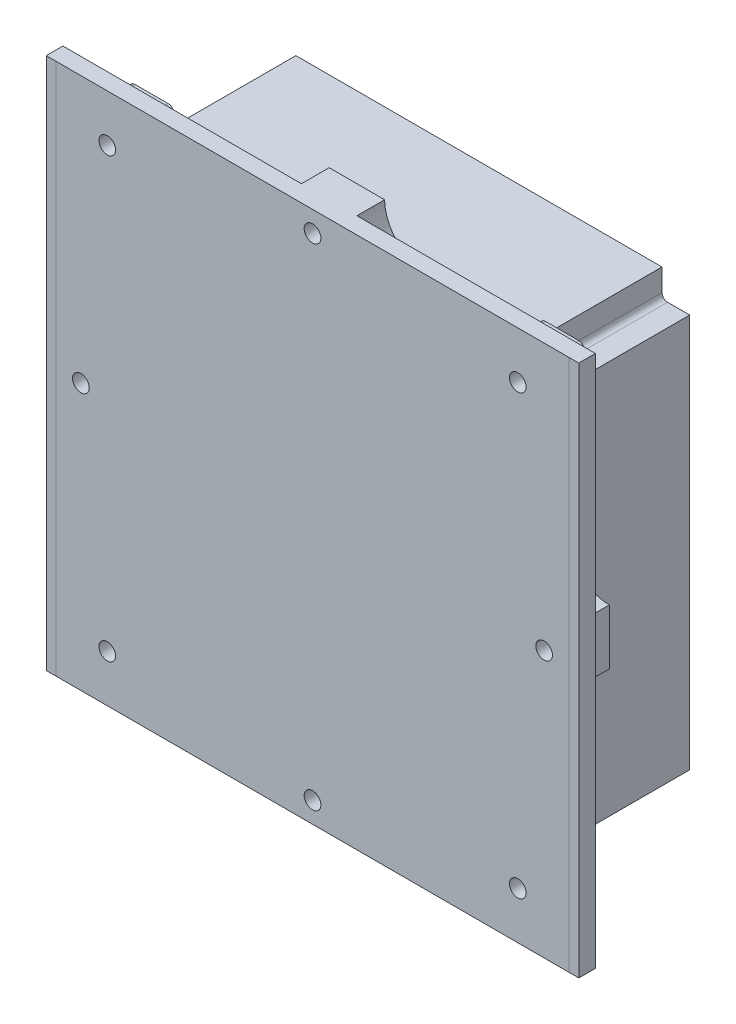
from build123d import *

# Parameters (mm, degrees)
SKETCH2_W           = 96
SKETCH2_H           = 96
BOSS_EXTRUDE1_DEPTH = 3
BOSS_EXTRUDE2_DEPTH = 27
BOSS_EXTRUDE6_DEPTH = 5
SKETCH18_R          = 1.5
CUT_EXTRUDE3_DEPTH  = 75.215901261
SKETCH16_W          = 5
SKETCH16_H          = 9.5
BOSS_EXTRUDE7_DEPTH = 15
SKETCH17_R          = 1.5
CUT_EXTRUDE2_DEPTH  = 3.175
FILLET2_R           = 1
SKETCH22_R          = 1.5
CUT_EXTRUDE5_DEPTH  = 75.215901261
CUT_EXTRUDE6_START  = -22
SKETCH23_R          = 1.5
CUT_EXTRUDE6_DEPTH  = 22
SKETCH24_W          = 82
SKETCH24_H          = 87
SKETCH24_W_2        = 76
SKETCH24_H_2        = 81
CUT_EXTRUDE8_DEPTH  = 22


with BuildPart() as part:
    # Sketch2 → Boss-Extrude1 (new body)
    with BuildSketch(Plane.XY):
        Rectangle(SKETCH2_W, SKETCH2_H)
    extrude(amount=-BOSS_EXTRUDE1_DEPTH)

    # Sketch3 → Boss-Extrude2 (add)
    with BuildSketch(Plane(origin=(0, 0, -3), x_dir=(-1, 0, 0), z_dir=(0, 0, -1))):
        with BuildLine():
            ThreePointArc((-33, -42.5), (-32.414213562, -41.085786438), (-31, -40.5))
            Line((-31, -40.5), (31, -40.5))
            ThreePointArc((31, -40.5), (32.414213562, -41.085786438), (33, -42.5))
            Line((33, -42.5), (33, -43.5))
            Line((33, -43.5), (41, -43.5))
            Line((41, -43.5), (41, -35.5))
            Line((41, -35.5), (40, -35.5))
            ThreePointArc((40, -35.5), (38.585786438, -34.914213562), (38, -33.5))
            Line((38, -33.5), (38, 33.5))
            ThreePointArc((38, 33.5), (38.585786438, 34.914213562), (40, 35.5))
            Line((40, 35.5), (41, 35.5))
            Line((41, 35.5), (41, 43.5))
            Line((41, 43.5), (33, 43.5))
            Line((33, 43.5), (33, 42.5))
            ThreePointArc((33, 42.5), (32.414213562, 41.085786438), (31, 40.5))
            Line((31, 40.5), (-31, 40.5))
            ThreePointArc((-31, 40.5), (-32.414213562, 41.085786438), (-33, 42.5))
            Line((-33, 42.5), (-33, 43.5))
            Line((-33, 43.5), (-41, 43.5))
            Line((-41, 43.5), (-41, 35.5))
            Line((-41, 35.5), (-40, 35.5))
            ThreePointArc((-40, 35.5), (-38.585786438, 34.914213562), (-38, 33.5))
            Line((-38, 33.5), (-38, -33.5))
            ThreePointArc((-38, -33.5), (-38.585786438, -34.914213562), (-40, -35.5))
            Line((-40, -35.5), (-41, -35.5))
            Line((-41, -35.5), (-41, -43.5))
            Line((-41, -43.5), (-33, -43.5))
            Line((-33, -43.5), (-33, -42.5))
        make_face()
        with BuildLine():
            Line((-35, -22.5), (-35, 22.5))
            ThreePointArc((-35, 22.5), (-30.606601718, 33.106601718), (-20, 37.5))
            Line((-20, 37.5), (20, 37.5))
            ThreePointArc((20, 37.5), (30.606601718, 33.106601718), (35, 22.5))
            Line((35, 22.5), (35, -22.5))
            ThreePointArc((35, -22.5), (30.606601718, -33.106601718), (20, -37.5))
            Line((20, -37.5), (-20, -37.5))
            ThreePointArc((-20, -37.5), (-30.606601718, -33.106601718), (-35, -22.5))
        make_face(mode=Mode.SUBTRACT)
    extrude(amount=BOSS_EXTRUDE2_DEPTH)

    # Sketch15 → Boss-Extrude6 (add)
    with BuildSketch(Plane(origin=(0, 0, -3), x_dir=(-1, 0, 0), z_dir=(0, 0, -1))):
        with BuildLine():
            Line((-5, 48), (5, 48))
            ThreePointArc((5, 48), (7.196699141, 42.696699141), (12.5, 40.5))
            Line((12.5, 40.5), (-12.5, 40.5))
            ThreePointArc((-12.5, 40.5), (-7.196699141, 42.696699141), (-5, 48))
        make_face()
        with BuildLine():
            Line((45.5, 5), (45.5, -5))
            ThreePointArc((45.5, -5), (40.196699141, -7.196699141), (38, -12.5))
            Line((38, -12.5), (38, 12.5))
            ThreePointArc((38, 12.5), (40.196699141, 7.196699141), (45.5, 5))
        make_face()
        with BuildLine():
            Line((5, -48), (-5, -48))
            ThreePointArc((-5, -48), (-7.196699141, -42.696699141), (-12.5, -40.5))
            Line((-12.5, -40.5), (12.5, -40.5))
            ThreePointArc((12.5, -40.5), (7.196699141, -42.696699141), (5, -48))
        make_face()
        with BuildLine():
            Line((-45.5, -5), (-45.5, 5))
            ThreePointArc((-45.5, 5), (-40.196699141, 7.196699141), (-38, 12.5))
            Line((-38, 12.5), (-38, -12.5))
            ThreePointArc((-38, -12.5), (-40.196699141, -7.196699141), (-45.5, -5))
        make_face()
    extrude(amount=BOSS_EXTRUDE6_DEPTH)

    # Sketch18 → Cut-Extrude3 (cut, through all)
    with BuildSketch(Plane.XY):
        with Locations((0, 44.25)):
            Circle(SKETCH18_R)
        with Locations((0, -44.25)):
            Circle(SKETCH18_R)
        with Locations((41.75, 0)):
            Circle(SKETCH18_R)
        with Locations((-41.75, 0)):
            Circle(SKETCH18_R)
    extrude(amount=-CUT_EXTRUDE3_DEPTH, mode=Mode.SUBTRACT)

    # Sketch16 → Boss-Extrude7 (add)
    with BuildSketch(Plane(origin=(0, 0, -3), x_dir=(-1, 0, 0), z_dir=(0, 0, -1))):
        with Locations((-32.5, 17.75)):
            Rectangle(SKETCH16_W, SKETCH16_H)
        with Locations((32.5, 17.75)):
            Rectangle(SKETCH16_W, SKETCH16_H)
    extrude(amount=BOSS_EXTRUDE7_DEPTH)

    # Sketch17 → Cut-Extrude2 (cut)
    with BuildSketch(Plane(origin=(0, 0, -18), x_dir=(-1, 0, 0), z_dir=(0, 0, -1))):
        with Locations((-32.5, 17.75)):
            Circle(SKETCH17_R)
        with Locations((32.5, 17.75)):
            Circle(SKETCH17_R)
    extrude(amount=-CUT_EXTRUDE2_DEPTH, mode=Mode.SUBTRACT)

    # Fillet2
    fillet2_edges = [part.edges().sort_by_distance(p)[0] for p in [
        (-33, 43.5, -16.5),
        (-41, 35.5, -16.5),
        (-41, 43.5, -16.5),
        (33, 43.5, -16.5),
        (41, 43.5, -16.5),
        (41, 35.5, -16.5),
        (41, -35.5, -16.5),
        (33, -43.5, -16.5),
        (-33, -43.5, -16.5),
        (-41, -35.5, -16.5),
        (-41, -43.5, -16.5),
        (41, -43.5, -16.5),
    ]]
    fillet(fillet2_edges, radius=FILLET2_R - 0.0001)  # a hair under: the kernel refuses the full size

    # Sketch22 → Cut-Extrude5 (cut, through all)
    with BuildSketch(Plane.XY):
        with Locations((37, 39.5)):
            Circle(SKETCH22_R)
        with Locations(Location((-37, 39.5, 0), (0, 0, 180))):
            Circle(SKETCH22_R)
        with Locations(Location((37, -39.5, 0), (0, 0, 180))):
            Circle(SKETCH22_R)
        with Locations((-37, -39.5)):
            Circle(SKETCH22_R)
    extrude(amount=-CUT_EXTRUDE5_DEPTH, mode=Mode.SUBTRACT)

    # Sketch23 → Cut-Extrude6 (cut)
    # profile 1 of 4: a face of its own
    with BuildSketch(Plane(origin=(0, 0, -30), x_dir=(-1, 0, 0), z_dir=(0, 0, -1)).offset(CUT_EXTRUDE6_START)):
        with BuildLine():
            ThreePointArc((34, 35.5), (33.292893219, 35.792893219), (33, 36.5))
            Line((33, 36.5), (33, 42.5))
            ThreePointArc((33, 42.5), (33.292893219, 43.207106781), (34, 43.5))
            Line((34, 43.5), (40, 43.5))
            ThreePointArc((40, 43.5), (40.707106781, 43.207106781), (41, 42.5))
            Line((41, 42.5), (41, 36.5))
            ThreePointArc((41, 36.5), (40.707106781, 35.792893219), (40, 35.5))
            Line((40, 35.5), (34, 35.5))
        make_face()
        with Locations(Location((37, 39.5, 0), (0, 0, 180))):
            Circle(SKETCH23_R, mode=Mode.SUBTRACT)
    # profile 2 of 4: a face of its own
    with BuildSketch(Plane(origin=(0, 0, -30), x_dir=(-1, 0, 0), z_dir=(0, 0, -1)).offset(CUT_EXTRUDE6_START)):
        with BuildLine():
            Line((-34, 35.5), (-40, 35.5))
            ThreePointArc((-40, 35.5), (-40.707106781, 35.792893219), (-41, 36.5))
            Line((-41, 36.5), (-41, 42.5))
            ThreePointArc((-41, 42.5), (-40.707106781, 43.207106781), (-40, 43.5))
            Line((-40, 43.5), (-34, 43.5))
            ThreePointArc((-34, 43.5), (-33.292893219, 43.207106781), (-33, 42.5))
            Line((-33, 42.5), (-33, 36.5))
            ThreePointArc((-33, 36.5), (-33.292893219, 35.792893219), (-34, 35.5))
        make_face()
        with Locations(Location((-37, 39.5, 0), (0, 0, 180))):
            Circle(SKETCH23_R, mode=Mode.SUBTRACT)
    # profile 3 of 4: a face of its own
    with BuildSketch(Plane(origin=(0, 0, -30), x_dir=(-1, 0, 0), z_dir=(0, 0, -1)).offset(CUT_EXTRUDE6_START)):
        with BuildLine():
            ThreePointArc((-34, -35.5), (-33.292893219, -35.792893219), (-33, -36.5))
            Line((-33, -36.5), (-33, -42.5))
            ThreePointArc((-33, -42.5), (-33.292893219, -43.207106781), (-34, -43.5))
            Line((-34, -43.5), (-40, -43.5))
            ThreePointArc((-40, -43.5), (-40.707106781, -43.207106781), (-41, -42.5))
            Line((-41, -42.5), (-41, -36.5))
            ThreePointArc((-41, -36.5), (-40.707106781, -35.792893219), (-40, -35.5))
            Line((-40, -35.5), (-34, -35.5))
        make_face()
        with Locations(Location((-37, -39.5, 0), (0, 0, 180))):
            Circle(SKETCH23_R, mode=Mode.SUBTRACT)
    # profile 4 of 4: a face of its own
    with BuildSketch(Plane(origin=(0, 0, -30), x_dir=(-1, 0, 0), z_dir=(0, 0, -1)).offset(CUT_EXTRUDE6_START)):
        with BuildLine():
            Line((34, -35.5), (40, -35.5))
            ThreePointArc((40, -35.5), (40.707106781, -35.792893219), (41, -36.5))
            Line((41, -36.5), (41, -42.5))
            ThreePointArc((41, -42.5), (40.707106781, -43.207106781), (40, -43.5))
            Line((40, -43.5), (34, -43.5))
            ThreePointArc((34, -43.5), (33.292893219, -43.207106781), (33, -42.5))
            Line((33, -42.5), (33, -36.5))
            ThreePointArc((33, -36.5), (33.292893219, -35.792893219), (34, -35.5))
        make_face()
        with Locations(Location((37, -39.5, 0), (0, 0, 180))):
            Circle(SKETCH23_R, mode=Mode.SUBTRACT)
    extrude(amount=CUT_EXTRUDE6_DEPTH, mode=Mode.SUBTRACT)

    # Sketch24 → Cut-Extrude8 (cut)
    with BuildSketch(Plane(origin=(0, 0, -30), x_dir=(-1, 0, 0), z_dir=(0, 0, -1))):
        Rectangle(SKETCH24_W, SKETCH24_H)
        Rectangle(SKETCH24_W_2, SKETCH24_H_2, mode=Mode.SUBTRACT)
    extrude(amount=-CUT_EXTRUDE8_DEPTH, mode=Mode.SUBTRACT)


solid = part.part
